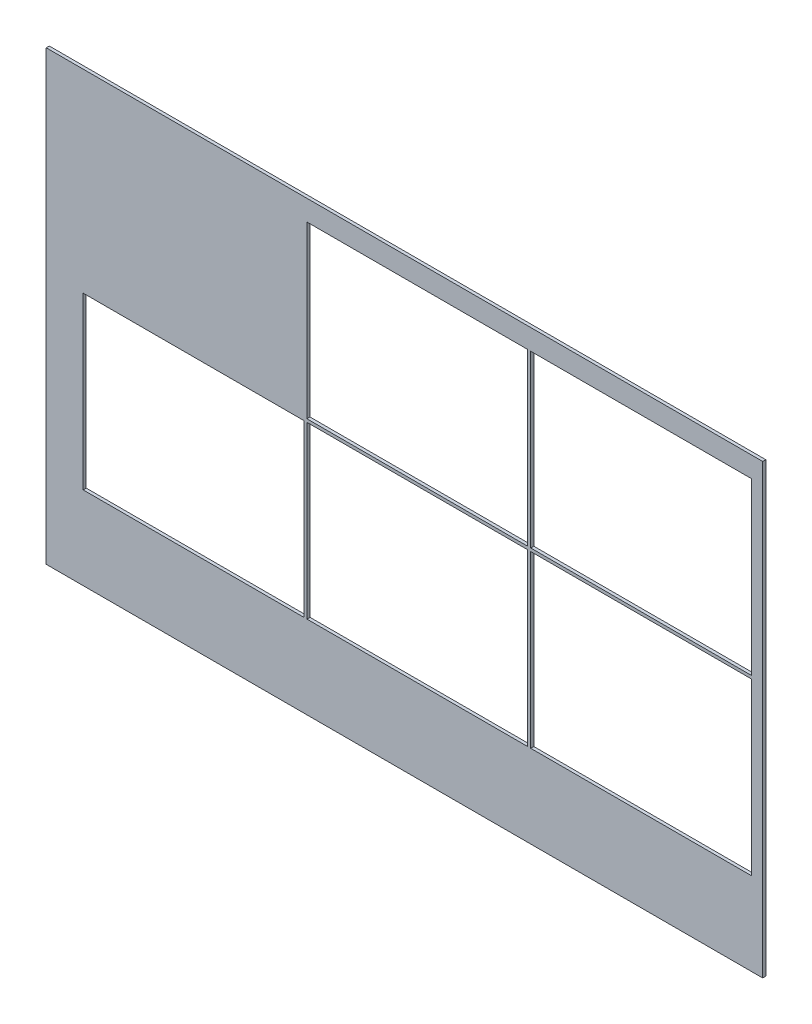
from build123d import *

# Parameters (mm, degrees)
SKETCH_1_W                  = 1396
SKETCH_1_H                  = 871.6
EXTRUDE_1_DEPTH             = 6
SKETCH_2_W                  = 430
SKETCH_2_H                  = 332
CUT_EXTRUDE_1_DEPTH         = 1045.298156658
PATTERN_LINEAR_1_COUNT      = 2
PATTERN_LINEAR_1_PITCH      = 436
PATTERN_LINEAR_1_COUNT_DIR2 = 2
PATTERN_LINEAR_1_PITCH_DIR2 = 338
SKETCH_3_W                  = 430
SKETCH_3_H                  = 332
CUT_EXTRUDE_2_DEPTH         = 1045.298156658


with BuildPart() as part:
    # Эскиз1 → Бобышка-Вытянуть1 (new body)
    with BuildSketch(Plane.XY):
        with Locations((-251, 0)):
            Rectangle(SKETCH_1_W, SKETCH_1_H)
    extrude(amount=-EXTRUDE_1_DEPTH)

    # Эскиз2 → Вырез-Вытянуть1 (cut, through all)
    with BuildSketch(Plane.XY):
        with Locations((-226, 229.8)):
            Rectangle(SKETCH_2_W, SKETCH_2_H)
    cut_extrude_1 = extrude(amount=-CUT_EXTRUDE_1_DEPTH, mode=Mode.SUBTRACT)

    # Линейный массив1: Cut-Extrude 1 2 × 2
    with Locations(*[(i * PATTERN_LINEAR_1_PITCH, -j * PATTERN_LINEAR_1_PITCH_DIR2, 0) for i in range(PATTERN_LINEAR_1_COUNT) for j in range(PATTERN_LINEAR_1_COUNT_DIR2) if (i, j) != (0, 0)]):
        add(cut_extrude_1, mode=Mode.SUBTRACT)

    # Эскиз3 → Вырез-Вытянуть2 (cut, through all)
    with BuildSketch(Plane.XY):
        with Locations((-662, -108.2)):
            Rectangle(SKETCH_3_W, SKETCH_3_H)
    extrude(amount=-CUT_EXTRUDE_2_DEPTH, mode=Mode.SUBTRACT)


solid = part.part
